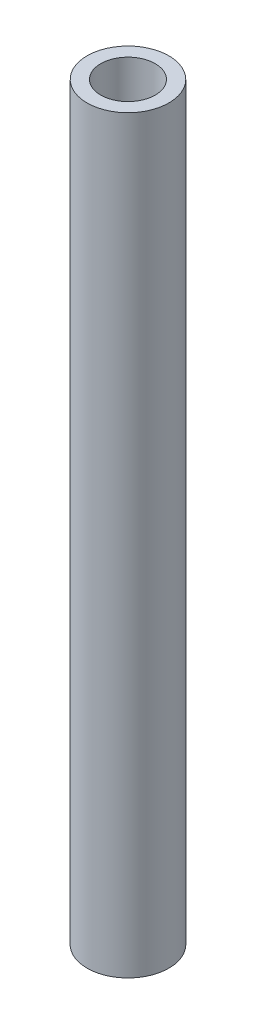
from build123d import *

# Parameters (mm, degrees)
SZKIC1_R                    = 6
DODANIE_WYCI_GNI_CIE1_DEPTH = 110
SZKIC2_R                    = 4
WYTNIJ_WYCI_GNI_CIE1_DEPTH  = 30
WYTNIJ_WYCI_GNI_CIE2_START  = -30
SZKIC5_R                    = 4
WYTNIJ_WYCI_GNI_CIE2_DEPTH  = 30


with BuildPart() as part:
    # Szkic1 → Dodanie-wyciągnięcie1 (new body)
    with BuildSketch(Plane(origin=(0, 0, 0), x_dir=(1, 0, 0), z_dir=(0, 1, 0))):
        Circle(SZKIC1_R)
    extrude(amount=DODANIE_WYCI_GNI_CIE1_DEPTH)

    # Szkic2 → Wytnij-wyciągnięcie1 (cut)
    with BuildSketch(Plane(origin=(0, 110, 0), x_dir=(1, 0, 0), z_dir=(0, 1, 0))):
        Circle(SZKIC2_R)
    extrude(amount=-WYTNIJ_WYCI_GNI_CIE1_DEPTH, mode=Mode.SUBTRACT)

    # Szkic5 → Wytnij-wyciągnięcie2 (cut)
    with BuildSketch(Plane.XZ.offset(WYTNIJ_WYCI_GNI_CIE2_START)):
        Circle(SZKIC5_R)
    extrude(amount=WYTNIJ_WYCI_GNI_CIE2_DEPTH, mode=Mode.SUBTRACT)


solid = part.part
